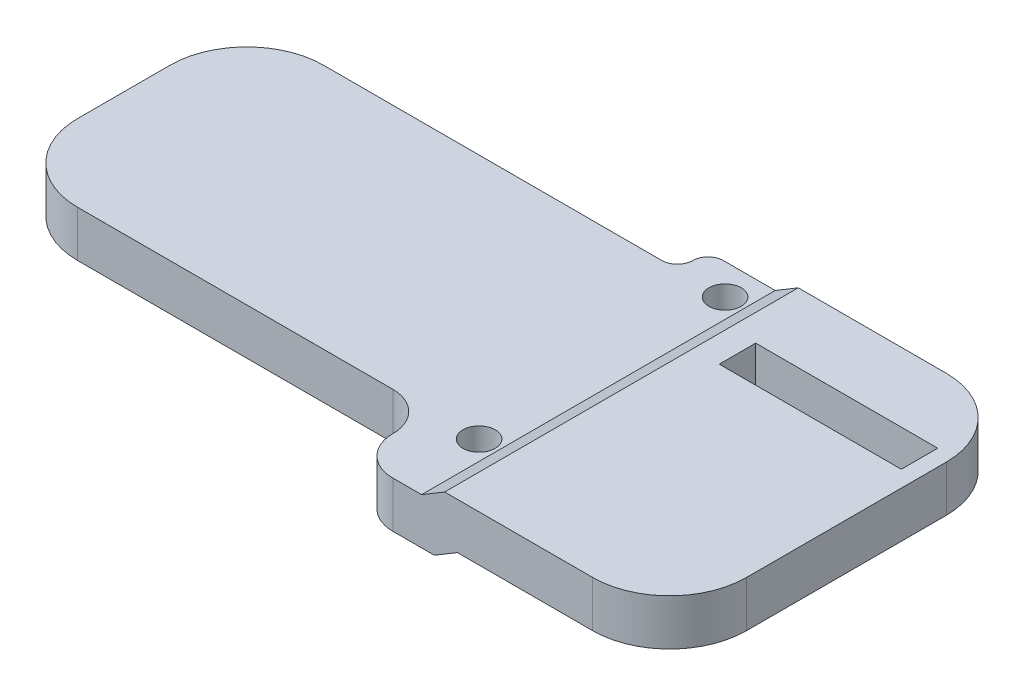
from build123d import *

# Parameters (mm, degrees)
SKETCH1_W               = 28
SKETCH1_H               = 16
BOSS_EXTRUDE1_DEPTH     = 3
BOSS_EXTRU_1_DEPTH      = 5
BOSS_EXTRU_1_DEPTH_BACK = 18
ESQUISSE8_W             = 11.84
ESQUISSE8_H             = 2.37
ENL_V_MAT_EXTRU_4_DEPTH = 10
ESQUISSE9_W             = 22.6
ESQUISSE9_H             = 11.84
ENL_V_MAT_EXTRU_5_DEPTH = 1
ESQUISSE10_R            = 1.05
ENL_V_MAT_EXTRU_6_DEPTH = 52.879282956
CONG_3_R                = 1
CONG_4_R                = 5
CONG_5_R                = 2.5


with BuildPart() as part:
    # Sketch1 → Boss-Extrude1 (new body)
    with BuildSketch(Plane(origin=(0, 0, 0), x_dir=(1, 0, 0), z_dir=(0, 1, 0))):
        with Locations((14, 8)):
            Rectangle(SKETCH1_W, SKETCH1_H)
    extrude(amount=BOSS_EXTRUDE1_DEPTH)

    # Esquisse1 → Boss.-Extru.1 (add, two sides: drawn at the far end of the back side and taken through both)
    with BuildSketch(Plane.XY.offset(-BOSS_EXTRU_1_DEPTH_BACK)):
        Polygon((32.369048105, 3), (33.869048105, 3.9), (48.5, 3.9), (48.5, 0.9), (34.7, 0.9), (33.2, 0), (28, 0), (28, 3), align=None)
    extrude(amount=BOSS_EXTRU_1_DEPTH + BOSS_EXTRU_1_DEPTH_BACK)

    # Esquisse8 → Enlèv. mat.-Extru.4 (cut)
    with BuildSketch(Plane(origin=(0, 3.9, 0), x_dir=(1, 0, 0), z_dir=(0, 1, 0))):
        with Locations((41.52, 12.315)):
            Rectangle(ESQUISSE8_W, ESQUISSE8_H)
    extrude(amount=-ENL_V_MAT_EXTRU_4_DEPTH, mode=Mode.SUBTRACT)

    # Esquisse9 → Enlèv. mat.-Extru.5 (cut)
    with BuildSketch(Plane.XZ):
        with Locations((15.8, -8)):
            Rectangle(ESQUISSE9_W, ESQUISSE9_H)
    extrude(amount=-ENL_V_MAT_EXTRU_5_DEPTH, mode=Mode.SUBTRACT)

    # Esquisse10 → Enlèv. mat.-Extru.6 (cut, through all)
    with BuildSketch(Plane.XZ):
        with Locations(Location((31.11, 0, 0), (0, 0, 270))):
            Circle(ESQUISSE10_R)
        with Locations(Location((31.11, -16, 0), (0, 0, 270))):
            Circle(ESQUISSE10_R)
    extrude(amount=-ENL_V_MAT_EXTRU_6_DEPTH, mode=Mode.SUBTRACT)

    # Congé3
    cong_3_edges = [part.edges().sort_by_distance(p)[0] for p in [
        (28, 1.5, -16),
    ]]
    fillet(cong_3_edges, radius=CONG_3_R)
    cong_3_2_edges = [part.edges().sort_by_distance(p)[0] for p in [
        (28, 1.5, -18),
    ]]
    fillet(cong_3_2_edges, radius=CONG_3_R - 0.0001)  # a hair under: the kernel refuses the full size

    # Congé4
    cong_4_edges = [part.edges().sort_by_distance(p)[0] for p in [
        (48.5, 2.4, -18),
        (48.5, 2.4, 5),
        (0, 1.5, 0),
        (0, 1.5, -16),
    ]]
    fillet(cong_4_edges, radius=CONG_4_R)

    # Congé5
    cong_5_edges = [part.edges().sort_by_distance(p)[0] for p in [
        (28, 1.5, 0),
    ]]
    fillet(cong_5_edges, radius=CONG_5_R)
    cong_5_2_edges = [part.edges().sort_by_distance(p)[0] for p in [
        (28, 1.5, 5),
    ]]
    fillet(cong_5_2_edges, radius=CONG_5_R - 0.0001)  # a hair under: the kernel refuses the full size


solid = part.part
